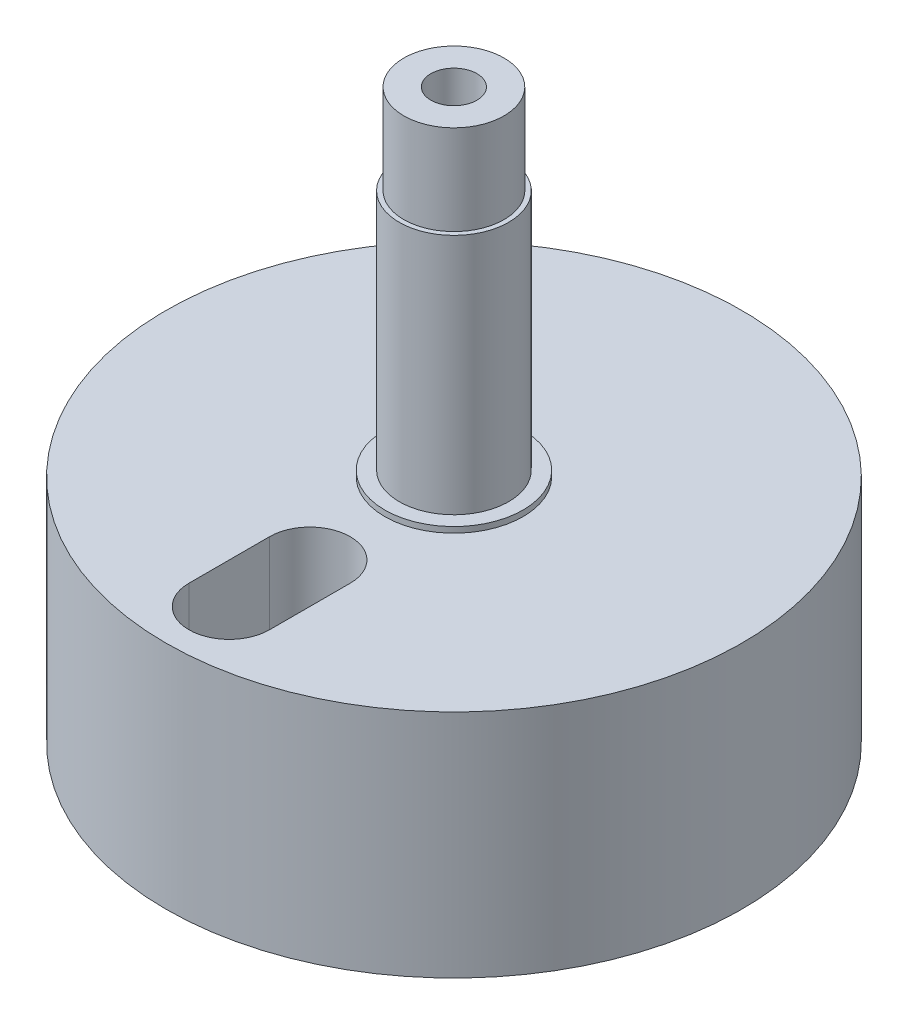
from build123d import *

# Parameters (mm, degrees)
SKETCH1_R           = 25
BOSS_EXTRUDE1_DEPTH = 20
CUT_EXTRUDE2_DEPTH  = 10
SKETCH5_R           = 2
CUT_EXTRUDE3_DEPTH  = 37.742346142
SKETCH2_R           = 6
BOSS_EXTRUDE2_DEPTH = 0.5
SKETCH7_R           = 4.75
BOSS_EXTRUDE3_DEPTH = 21
SKETCH8_R           = 4.35
BOSS_EXTRUDE4_DEPTH = 7.8
SKETCH6_R           = 2
CUT_EXTRUDE4_DEPTH  = 61.667042123


with BuildPart() as part:
    # Sketch1 → Boss-Extrude1 (new body)
    with BuildSketch(Plane(origin=(0, 0, 0), x_dir=(1, 0, 0), z_dir=(0, 1, 0))):
        Circle(SKETCH1_R)
    extrude(amount=BOSS_EXTRUDE1_DEPTH)

    # Sketch3 → Cut-Extrude2 (cut)
    with BuildSketch(Plane(origin=(0, 20, 0), x_dir=(1, 0, 0), z_dir=(0, 1, 0))):
        with BuildLine():
            Line((-3.5, -12.5), (-3.5, -19.5))
            ThreePointArc((-3.5, -19.5), (0, -23), (3.5, -19.5))
            Line((3.5, -19.5), (3.5, -12.5))
            ThreePointArc((3.5, -12.5), (0, -9), (-3.5, -12.5))
        make_face()
    extrude(amount=-CUT_EXTRUDE2_DEPTH, mode=Mode.SUBTRACT)

    # Sketch5 → Cut-Extrude3 (cut, through all)
    with BuildSketch(Plane(origin=(0, 10, 0), x_dir=(1, 0, 0), z_dir=(0, 1, 0))):
        with Locations((0, -16)):
            Circle(SKETCH5_R)
    extrude(amount=-CUT_EXTRUDE3_DEPTH, mode=Mode.SUBTRACT)

    # Sketch2 → Boss-Extrude2 (add)
    with BuildSketch(Plane(origin=(0, 20, 0), x_dir=(1, 0, 0), z_dir=(0, 1, 0))):
        Circle(SKETCH2_R)
    extrude(amount=BOSS_EXTRUDE2_DEPTH)

    # Sketch7 → Boss-Extrude3 (add)
    with BuildSketch(Plane(origin=(0, 20.5, 0), x_dir=(1, 0, 0), z_dir=(0, 1, 0))):
        Circle(SKETCH7_R)
    extrude(amount=BOSS_EXTRUDE3_DEPTH)

    # Sketch8 → Boss-Extrude4 (add)
    with BuildSketch(Plane(origin=(0, 41.5, 0), x_dir=(1, 0, 0), z_dir=(0, 1, 0))):
        Circle(SKETCH8_R)
    extrude(amount=BOSS_EXTRUDE4_DEPTH)

    # Sketch6 → Cut-Extrude4 (cut, through all)
    with BuildSketch(Plane.XZ):
        Circle(SKETCH6_R)
    extrude(amount=-CUT_EXTRUDE4_DEPTH, mode=Mode.SUBTRACT)


solid = part.part
